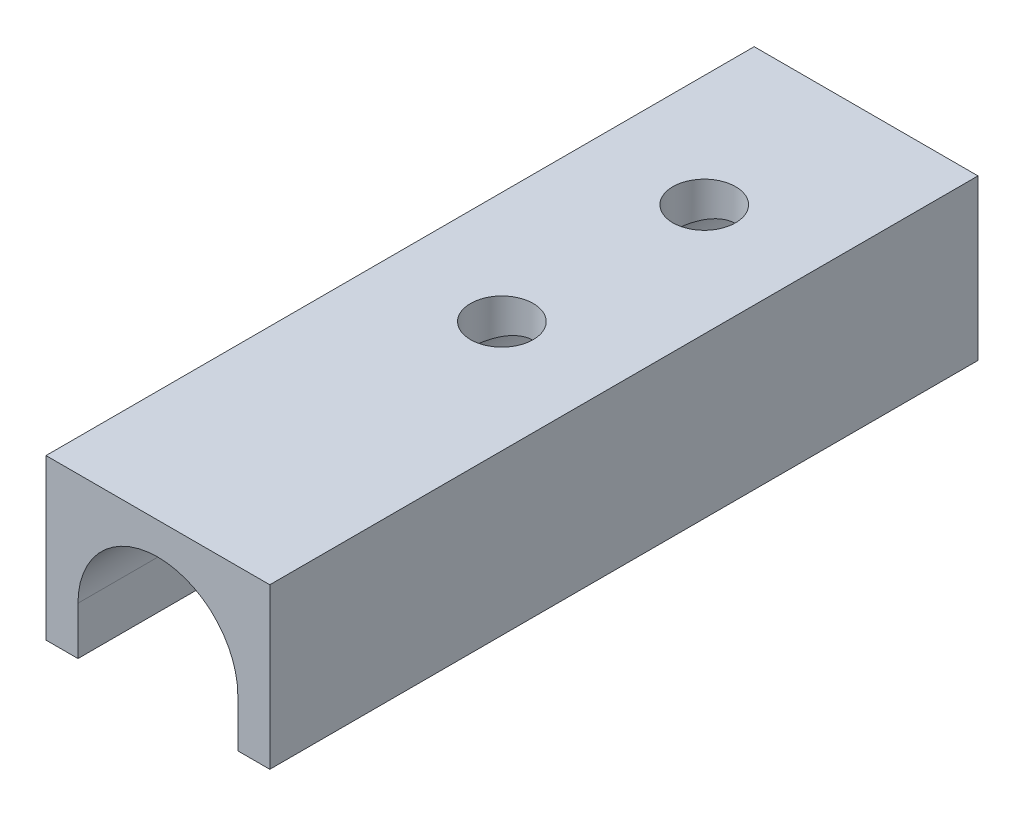
from build123d import *

# Parameters (mm, degrees)
BOSS_EXTRUDE1_DEPTH     = 17.5
CUT_EXTRUDE1_REACH      = 21.981
CUT_EXTRUDE1_END_RADIUS = 3.95
SKETCH2_R               = 1.55


with BuildPart() as part:
    # Sketch1 → Boss-Extrude1 (new, symmetric)
    with BuildSketch(Plane.XY):
        with BuildLine():
            Line((-5.53, 5.53), (5.53, 5.53))
            Line((5.53, 5.53), (5.53, -2.37))
            Line((5.53, -2.37), (3.95, -2.37))
            Line((3.95, -2.37), (3.95, 0))
            ThreePointArc((3.95, 0), (0, 3.95), (-3.95, 0))
            Line((-3.95, 0), (-3.95, -2.37))
            Line((-3.95, -2.37), (-5.53, -2.37))
            Line((-5.53, -2.37), (-5.53, 5.53))
        make_face()
    extrude(amount=BOSS_EXTRUDE1_DEPTH, both=True)

    # Cut-Extrude1: up to this cylinder (the profile starts outside it)
    cut_extrude1_end = Plane(origin=(0, 0, -4.5), z_dir=(0, 0, -1)) * Cylinder(CUT_EXTRUDE1_END_RADIUS, 62.862, mode=Mode.PRIVATE)
    # Sketch2 → Cut-Extrude1 (cut, up to the surface)
    with BuildSketch(Plane(origin=(0, 5.53, 0), x_dir=(1, 0, 0), z_dir=(0, 1, 0)), mode=Mode.PRIVATE) as cut_extrude1_sk1:
        with Locations((0, 9.5)):
            Circle(SKETCH2_R)
    cut_extrude1_tool1 = extrude(cut_extrude1_sk1.sketch, amount=-CUT_EXTRUDE1_REACH, mode=Mode.PRIVATE) - cut_extrude1_end
    add(cut_extrude1_tool1.solids().sort_by_distance((0, 5.53, -9.5))[0], mode=Mode.SUBTRACT)
    # Sketch2 → Cut-Extrude1 (cut, up to the surface)
    with BuildSketch(Plane(origin=(0, 5.53, 0), x_dir=(1, 0, 0), z_dir=(0, 1, 0)), mode=Mode.PRIVATE) as cut_extrude1_sk2:
        with Locations((0, -0.5)):
            Circle(SKETCH2_R)
    cut_extrude1_tool2 = extrude(cut_extrude1_sk2.sketch, amount=-CUT_EXTRUDE1_REACH, mode=Mode.PRIVATE) - cut_extrude1_end
    add(cut_extrude1_tool2.solids().sort_by_distance((0, 5.53, 0.5))[0], mode=Mode.SUBTRACT)


solid = part.part
